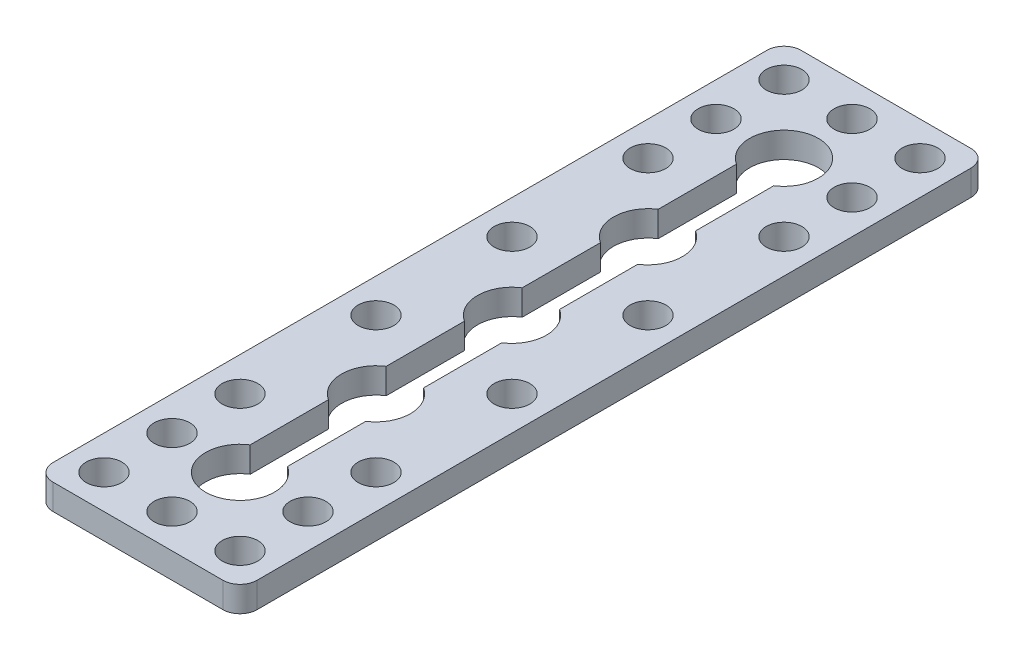
from build123d import *

# Parameters (mm, degrees)
SKETCH1_W           = 24
SKETCH1_H           = 88
BOSS_EXTRUDE1_DEPTH = 3
SKETCH2_R           = 2.1
CUT_EXTRUDE1_DEPTH  = 92.263355187
SKETCH3_R           = 4.05
CUT_EXTRUDE2_DEPTH  = 92.263355187
LPATTERN1_COUNT     = 5
LPATTERN1_PITCH     = 16
SKETCH4_W           = 4.4
SKETCH4_H           = 64
CUT_EXTRUDE3_DEPTH  = 92.263355187
FILLET1_R           = 2


with BuildPart() as part:
    # Sketch1 → Boss-Extrude1 (new body)
    with BuildSketch(Plane(origin=(0, 0, 0), x_dir=(1, 0, 0), z_dir=(0, 1, 0))):
        with Locations((12, 44)):
            Rectangle(SKETCH1_W, SKETCH1_H)
    extrude(amount=BOSS_EXTRUDE1_DEPTH)

    # Sketch2 → Cut-Extrude1 (cut, through all)
    with BuildSketch(Plane(origin=(0, 3, 0), x_dir=(1, 0, 0), z_dir=(0, 1, 0))):
        with Locations((12, 84)):
            Circle(SKETCH2_R)
        with Locations((4, 84)):
            Circle(SKETCH2_R)
        with Locations((4, 76)):
            Circle(SKETCH2_R)
        with Locations((4, 68)):
            Circle(SKETCH2_R)
        with Locations((4, 52)):
            Circle(SKETCH2_R)
        with Locations((20, 52)):
            Circle(SKETCH2_R)
        with Locations((20, 68)):
            Circle(SKETCH2_R)
        with Locations((20, 76)):
            Circle(SKETCH2_R)
        with Locations((20, 84)):
            Circle(SKETCH2_R)
        with Locations((20, 4)):
            Circle(SKETCH2_R)
        with Locations((20, 12)):
            Circle(SKETCH2_R)
        with Locations((20, 20)):
            Circle(SKETCH2_R)
        with Locations((20, 36)):
            Circle(SKETCH2_R)
        with Locations((4, 36)):
            Circle(SKETCH2_R)
        with Locations((4, 20)):
            Circle(SKETCH2_R)
        with Locations((4, 12)):
            Circle(SKETCH2_R)
        with Locations((4, 4)):
            Circle(SKETCH2_R)
        with Locations((12, 4)):
            Circle(SKETCH2_R)
    extrude(amount=-CUT_EXTRUDE1_DEPTH, mode=Mode.SUBTRACT)

    # Sketch3 → Cut-Extrude2 (cut, through all)
    with BuildSketch(Plane(origin=(0, 3, 0), x_dir=(1, 0, 0), z_dir=(0, 1, 0))):
        with Locations((12, 76)):
            Circle(SKETCH3_R)
    cut_extrude2 = extrude(amount=-CUT_EXTRUDE2_DEPTH, mode=Mode.SUBTRACT)

    # LPattern1: Cut-Extrude2 ×5
    with Locations(*[(0, 0, i * LPATTERN1_PITCH) for i in range(1, LPATTERN1_COUNT)]):
        add(cut_extrude2, mode=Mode.SUBTRACT)

    # Sketch4 → Cut-Extrude3 (cut, through all)
    with BuildSketch(Plane(origin=(0, 3, 0), x_dir=(1, 0, 0), z_dir=(0, 1, 0))):
        with Locations((12, 44)):
            Rectangle(SKETCH4_W, SKETCH4_H)
    extrude(amount=-CUT_EXTRUDE3_DEPTH, mode=Mode.SUBTRACT)

    # Fillet1
    fillet1_edges = [part.edges().sort_by_distance(p)[0] for p in [
        (24, 1.5, -88),
        (0, 1.5, -88),
        (0, 1.5, 0),
        (24, 1.5, 0),
    ]]
    fillet(fillet1_edges, radius=FILLET1_R)


solid = part.part
